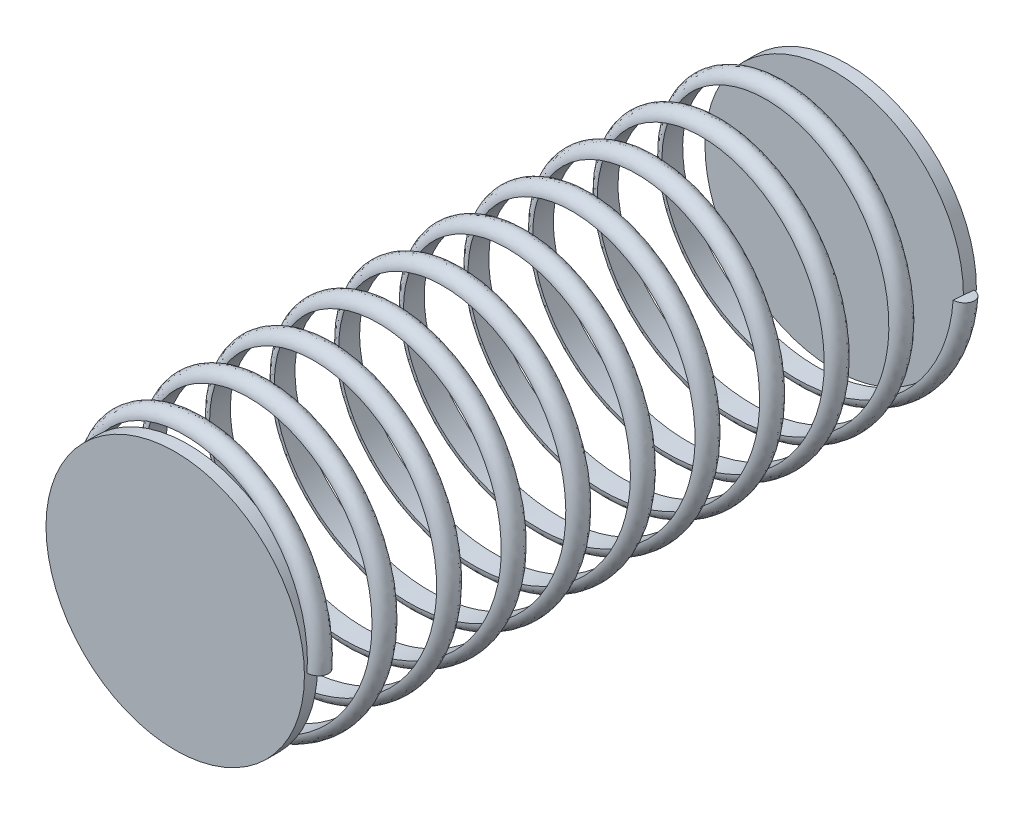
from build123d import *

# Parameters (mm, degrees)
SWEEP_1_PITCH        = 5
SWEEP_1_HEIGHT       = 50
SWEEP_1_RADIUS       = 10
SWEEP_1_PROFILE_R    = 0.8
EXTRUDE_3_DEPTH      = 51
EXTRUDE_3_DEPTH_BACK = 1
SKETCH_1_4_R         = 10
SKETCH_1_5_R         = 10
CUT_EXTRUDE_1_DEPTH  = 50


with BuildPart() as part:
    # 扫描1: sweep along a helix
    with BuildLine() as sweep_1_path:
        Helix(SWEEP_1_PITCH, SWEEP_1_HEIGHT, SWEEP_1_RADIUS, center=(0, 0, 0), direction=(0, 0, 1), lefthand=True)
    # 扫描1 profile (on start of the path) → 扫描1 (sweep)
    with BuildSketch(Plane(origin=(10, 0, 0), x_dir=(0, -0.07932669684366059, -0.9968486721503289), z_dir=(-5.275764766966595e-15, -0.9968486721503289, 0.07932669684366059))):
        Circle(SWEEP_1_PROFILE_R)
    sweep(path=sweep_1_path.line, is_frenet=True)

    # 草图1<4> → 凸台-拉伸3 (add, two sides: drawn at the far end of the back side and taken through both)
    with BuildSketch(Plane.XY.offset(-EXTRUDE_3_DEPTH_BACK)):
        Circle(SKETCH_1_4_R)
    extrude(amount=EXTRUDE_3_DEPTH + EXTRUDE_3_DEPTH_BACK)

    # 草图1<5> → 切除-拉伸1 (cut)
    with BuildSketch(Plane.XY):
        Circle(SKETCH_1_5_R)
    extrude(amount=CUT_EXTRUDE_1_DEPTH, mode=Mode.SUBTRACT)


solid = part.part
